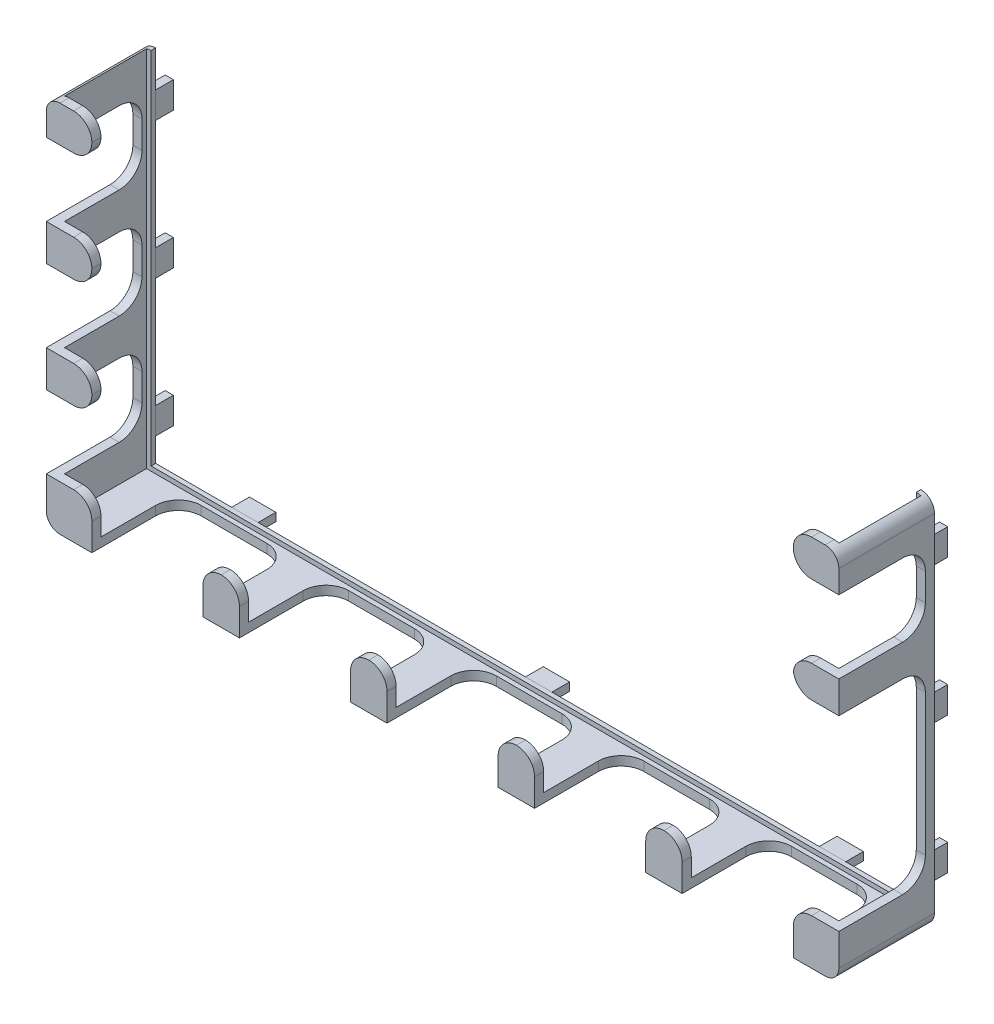
from build123d import *

# Parameters (mm, degrees)
SKETCH9_W               = 1.8
SKETCH9_H               = 5.8
BOSS_EXTRUDE8_DEPTH     = 4
BOSS_EXTRUDE8_2_DEPTH   = 4
BOSS_EXTRUDE8_3_DEPTH   = 4
BOSS_EXTRUDE8_4_DEPTH   = 4
BOSS_EXTRUDE8_5_DEPTH   = 4
BOSS_EXTRUDE8_6_DEPTH   = 4
SKETCH9_W_2             = 5.8
SKETCH9_H_2             = 1.8
BOSS_EXTRUDE8_7_DEPTH   = 4
BOSS_EXTRUDE8_8_DEPTH   = 4
BOSS_EXTRUDE8_9_DEPTH   = 4
BOSS_EXTRUDE5_DEPTH     = 19
BOSS_EXTRUDE6_DEPTH     = 2
BOSS_EXTRUDE11_DEPTH    = 1
CUT_EXTRUDE6_DEPTH      = 99.442876837
CUT_EXTRUDE6_DEPTH_BACK = 99.442876837
SKETCH18_W              = 19
SKETCH18_H              = 16
SKETCH19_W              = 24.4
SKETCH19_H              = 19
CUT_EXTRUDE8_DEPTH      = 99.442876837
CUT_EXTRUDE9_START      = -19
SKETCH10_W              = 10
SKETCH10_H              = 34
CUT_EXTRUDE9_DEPTH      = 19
FILLET3_R               = 4
FILLET4_R               = 5
FILLET5_R               = 3


with BuildPart() as part:
    # Sketch9 → Boss-Extrude8 (new body)
    with BuildSketch(Plane(origin=(0, 0, 0), x_dir=(1, 0, 0), z_dir=(0, 0, -1))):
        with Locations((-85, 30)):
            Rectangle(SKETCH9_W, SKETCH9_H)
    extrude(amount=BOSS_EXTRUDE8_DEPTH)



with BuildPart() as body_2:
    # Sketch9 → Boss-Extrude8 2 (new body)
    with BuildSketch(Plane(origin=(0, 0, 0), x_dir=(1, 0, 0), z_dir=(0, 0, -1))):
        with Locations((-85, 0)):
            Rectangle(SKETCH9_W, SKETCH9_H)
    extrude(amount=BOSS_EXTRUDE8_2_DEPTH)


with BuildPart() as body_3:
    # Sketch9 → Boss-Extrude8 3 (new body)
    with BuildSketch(Plane(origin=(0, 0, 0), x_dir=(1, 0, 0), z_dir=(0, 0, -1))):
        with Locations((-85, -30)):
            Rectangle(SKETCH9_W, SKETCH9_H)
    extrude(amount=BOSS_EXTRUDE8_3_DEPTH)


with BuildPart() as body_4:
    # Sketch9 → Boss-Extrude8 4 (new body)
    with BuildSketch(Plane(origin=(0, 0, 0), x_dir=(1, 0, 0), z_dir=(0, 0, -1))):
        with Locations((85, 30)):
            Rectangle(SKETCH9_W, SKETCH9_H)
    extrude(amount=BOSS_EXTRUDE8_4_DEPTH)


with BuildPart() as body_5:
    # Sketch9 → Boss-Extrude8 5 (new body)
    with BuildSketch(Plane(origin=(0, 0, 0), x_dir=(1, 0, 0), z_dir=(0, 0, -1))):
        with Locations((85, -30)):
            Rectangle(SKETCH9_W, SKETCH9_H)
    extrude(amount=BOSS_EXTRUDE8_5_DEPTH)


with BuildPart() as body_6:
    # Sketch9 → Boss-Extrude8 6 (new body)
    with BuildSketch(Plane(origin=(0, 0, 0), x_dir=(1, 0, 0), z_dir=(0, 0, -1))):
        with Locations((85, 0)):
            Rectangle(SKETCH9_W, SKETCH9_H)
    extrude(amount=BOSS_EXTRUDE8_6_DEPTH)


with BuildPart() as body_7:
    # Sketch9 → Boss-Extrude8 7 (new body)
    with BuildSketch(Plane(origin=(0, 0, 0), x_dir=(1, 0, 0), z_dir=(0, 0, -1))):
        with Locations((-64.5, 39)):
            Rectangle(SKETCH9_W_2, SKETCH9_H_2)
    extrude(amount=BOSS_EXTRUDE8_7_DEPTH)


with BuildPart() as body_8:
    # Sketch9 → Boss-Extrude8 8 (new body)
    with BuildSketch(Plane(origin=(0, 0, 0), x_dir=(1, 0, 0), z_dir=(0, 0, -1))):
        with Locations((0, 39)):
            Rectangle(SKETCH9_W_2, SKETCH9_H_2)
    extrude(amount=BOSS_EXTRUDE8_8_DEPTH)


with BuildPart() as body_9:
    # Sketch9 → Boss-Extrude8 9 (new body)
    with BuildSketch(Plane(origin=(0, 0, 0), x_dir=(1, 0, 0), z_dir=(0, 0, -1))):
        with Locations((64.5, 39)):
            Rectangle(SKETCH9_W_2, SKETCH9_H_2)
    extrude(amount=BOSS_EXTRUDE8_9_DEPTH)


with BuildPart() as part_1:
    add(part.part)

    add(body_2.part)  # Boss-Extrude5 merges body 2

    add(body_3.part)  # Boss-Extrude5 merges body 3

    add(body_4.part)  # Boss-Extrude5 merges body 4

    add(body_5.part)  # Boss-Extrude5 merges body 5

    add(body_6.part)  # Boss-Extrude5 merges body 6

    add(body_7.part)  # Boss-Extrude5 merges body 7

    add(body_8.part)  # Boss-Extrude5 merges body 8

    add(body_9.part)  # Boss-Extrude5 merges body 9
    # Sketch1 → Boss-Extrude5 (add)
    with BuildSketch(Plane.XY):
        Polygon((-87, 41), (-85, 41), (-85, -39), (85, -39), (85, 41), (87, 41), (87, -41), (-87, -41), align=None)
    extrude(amount=BOSS_EXTRUDE5_DEPTH)

    # Sketch7 → Boss-Extrude6 (add)
    with BuildSketch(Plane.XY.offset(19)):
        Polygon((-87, 41), (-77, 41), (-77, -31), (77, -31), (77, 41), (87, 41), (87, -41), (-87, -41), align=None)
    extrude(amount=BOSS_EXTRUDE6_DEPTH)

    # Sketch17 → Boss-Extrude11 (add)
    with BuildSketch(Plane.XY):
        Polygon((-84, 41), (-85, 41), (-85, -39), (85, -39), (85, 41), (84, 41), (84, -38), (-84, -38), align=None)
    extrude(amount=BOSS_EXTRUDE11_DEPTH)

    # Sketch18 → Cut-Extrude6 (cut, two sides: drawn at the far end of the back side and taken through both)
    with BuildSketch(Plane.ZY.offset(-CUT_EXTRUDE6_DEPTH_BACK)):
        with Locations((11.5, 25)):
            Rectangle(SKETCH18_W, SKETCH18_H)
        with Locations((11.5, 1)):
            Rectangle(SKETCH18_W, SKETCH18_H)
        with Locations((11.5, -23)):
            Rectangle(SKETCH18_W, SKETCH18_H)
    extrude(amount=CUT_EXTRUDE6_DEPTH + CUT_EXTRUDE6_DEPTH_BACK, mode=Mode.SUBTRACT)

    # Sketch19 → Cut-Extrude8 (cut, through all)
    with BuildSketch(Plane.XZ):
        with Locations((-64.8, 11.5)):
            Rectangle(SKETCH19_W, SKETCH19_H)
        with Locations((-32.4, 11.5)):
            Rectangle(SKETCH19_W, SKETCH19_H)
        with Locations((0, 11.5)):
            Rectangle(SKETCH19_W, SKETCH19_H)
        with Locations((32.4, 11.5)):
            Rectangle(SKETCH19_W, SKETCH19_H)
        with Locations((64.8, 11.5)):
            Rectangle(SKETCH19_W, SKETCH19_H)
    extrude(amount=CUT_EXTRUDE8_DEPTH, mode=Mode.SUBTRACT)

    # Sketch10 → Cut-Extrude9 (cut)
    with BuildSketch(Plane.XY.offset(21).offset(CUT_EXTRUDE9_START)):
        with Locations((82, -7)):
            Rectangle(SKETCH10_W, SKETCH10_H)
    extrude(amount=CUT_EXTRUDE9_DEPTH, mode=Mode.SUBTRACT)

    # Fillet3
    # the kernel refuses this fillet: 4 mm, written as the material it takes off along each edge
    with BuildSketch(Plane(origin=(77, 41, 9), x_dir=(0, -1, 0), z_dir=(0, 0, 1)), Plane(origin=(-77, 33, 9), x_dir=(0, 1, 0), z_dir=(0, 0, 1)), Plane(origin=(77, 17, 9), x_dir=(0, -1, 0), z_dir=(0, 0, 1)), Plane(origin=(-77, 17, 31), x_dir=(0, -1, 0), z_dir=(0, 0, -1)), Plane(origin=(-77, 9, 9), x_dir=(0, 1, 0), z_dir=(0, 0, 1)), Plane(origin=(-77, -7, 31), x_dir=(0, -1, 0), z_dir=(0, 0, -1)), Plane(origin=(-77, -15, 9), x_dir=(0, 1, 0), z_dir=(0, 0, 1)), Plane(origin=(-44.6, -31, 9), x_dir=(-1, 0, 0), z_dir=(0, 0, 1)), Plane(origin=(-12.2, -31, 9), x_dir=(-1, 0, 0), z_dir=(0, 0, 1)), Plane(origin=(20.2, -31, 9), x_dir=(-1, 0, 0), z_dir=(0, 0, 1)), Plane(origin=(52.6, -31, 9), x_dir=(-1, 0, 0), z_dir=(0, 0, 1)), Plane(origin=(77, 10, 9), x_dir=(1, 0, 0), z_dir=(0, 0, 1))) as fillet3_piece_1:
        with BuildLine():
            CenterArc((FILLET3_R, FILLET3_R), FILLET3_R, 180, 90)
            Line((0, FILLET3_R), (0, 0))
            Line((0, 0), (FILLET3_R, 0))
        make_face()
    extrude(amount=22, mode=Mode.SUBTRACT)
    with BuildSketch(Plane(origin=(-77, 41, 9), x_dir=(0, -1, 0), z_dir=(0, 0, 1)), Plane(origin=(77, 33, 31), x_dir=(1, 0, 0), z_dir=(0, 0, -1)), Plane(origin=(-77, -31, 9), x_dir=(0, -1, 0), z_dir=(0, 0, 1)), Plane(origin=(-52.6, -31, 31), x_dir=(0, -1, 0), z_dir=(0, 0, -1)), Plane(origin=(-20.2, -31, 31), x_dir=(0, -1, 0), z_dir=(0, 0, -1)), Plane(origin=(12.2, -31, 31), x_dir=(0, -1, 0), z_dir=(0, 0, -1)), Plane(origin=(44.6, -31, 31), x_dir=(0, -1, 0), z_dir=(0, 0, -1)), Plane(origin=(77, -31, 31), x_dir=(0, -1, 0), z_dir=(0, 0, -1))) as fillet3_piece_2:
        with BuildLine():
            CenterArc((FILLET3_R, -FILLET3_R), FILLET3_R, 90, 90)
            Line((0, -FILLET3_R), (0, 0))
            Line((0, 0), (FILLET3_R, 0))
        make_face()
    extrude(amount=22, mode=Mode.SUBTRACT)

    # Fillet4
    fillet4_edges = [part_1.edges().sort_by_distance(p)[0] for p in [
        (86, 17, 2),
        (-86, 17, 2),
        (86, 33, 2),
        (-86, 33, 2),
        (-86, -7, 2),
        (-86, 9, 2),
        (86, -31, 2),
        (-86, -31, 2),
        (-86, -15, 2),
        (-77, -40, 2),
        (-52.6, -40, 2),
        (-44.6, -40, 2),
        (-20.2, -40, 2),
        (-12.2, -40, 2),
        (12.2, -40, 2),
        (20.2, -40, 2),
        (44.6, -40, 2),
        (52.6, -40, 2),
        (77, -40, 2),
        (86, 10, 2),
    ]]
    fillet(fillet4_edges, radius=FILLET4_R)

    # Fillet5
    fillet5_edges = [part_1.edges().sort_by_distance(p)[0] for p in [
        (-87, 41, 10.5),
        (-87, -41, 10.5),
        (87, -41, 10.5),
        (87, 41, 10.5),
    ]]
    fillet(fillet5_edges, radius=FILLET5_R)


solid = part_1.part
